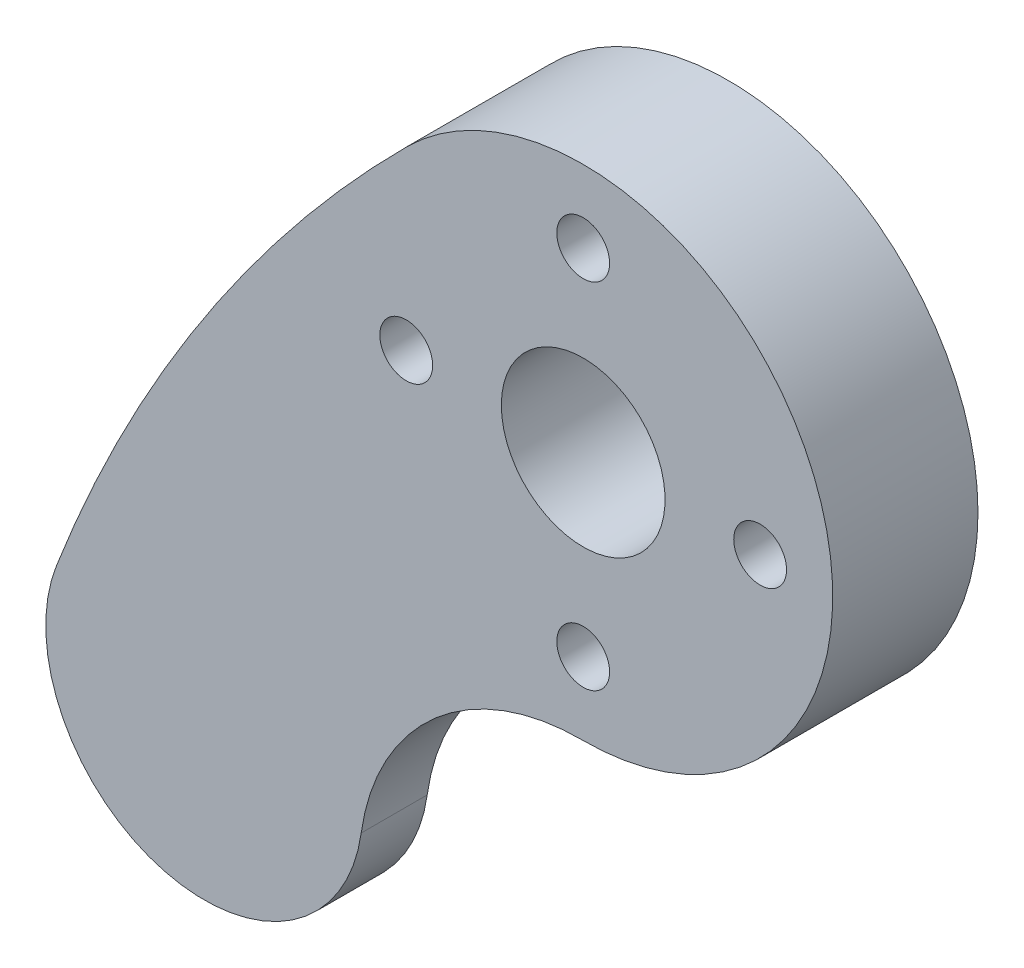
from build123d import *
from build123d.topology import SkipClean

# Parameters (mm, degrees)
BOSS_EXTRUDE1_DEPTH = 3.175
BOSS_EXTRUDE2_START = 3.81
SKETCH2_R           = 12
BOSS_EXTRUDE2_DEPTH = 3.81
SKETCH3_R           = 3.937
CUT_EXTRUDE1_DEPTH  = 134.099089527
SKETCH4_R           = 1.27
CUT_EXTRUDE2_DEPTH  = 134.099089527
CUT_EXTRUDE3_DEPTH  = 133.970273023


with BuildPart() as part:
    # Sketch1 → Boss-Extrude1 (new body)
    with BuildSketch(Plane.XY):
        with BuildLine():
            ThreePointArc((113.784062988, 44.416608597), (112.542436022, 60.902914722), (96.014300162, 60.502100346))
            ThreePointArc((96.014300162, 60.502100346), (86.225733854, 48.445051897), (79.156979953, 34.616777747))
            ThreePointArc((79.156979953, 34.616777747), (81.153408489, 26.227218543), (89.699693339, 25.073335615))
            ThreePointArc((89.699693339, 25.073335615), (102.758092485, 33.479680479), (113.784062988, 44.416608597))
        make_face()
    extrude(amount=BOSS_EXTRUDE1_DEPTH)

    # Sketch2 → Boss-Extrude2 (add)
    with SkipClean():  # the faces are left unmerged after this step: merging them gives an invalid solid
        with BuildSketch(Plane(origin=(0, 0, 0), x_dir=(-1, 0, 0), z_dir=(0, 0, -1)).offset(BOSS_EXTRUDE2_START)):
            with Locations((-104.48925, 52.0065)):
                Circle(SKETCH2_R)
        extrude(amount=-BOSS_EXTRUDE2_DEPTH)

    # Sketch3 → Cut-Extrude1 (cut, through all)
    with SkipClean():  # the faces are left unmerged after this step: merging them gives an invalid solid
        with BuildSketch(Plane(origin=(0, 0, -3.81), x_dir=(-1, 0, 0), z_dir=(0, 0, -1))):
            with Locations((-104.48925, 52.0065)):
                Circle(SKETCH3_R)
        extrude(amount=-CUT_EXTRUDE1_DEPTH, mode=Mode.SUBTRACT)

    # Sketch4 → Cut-Extrude2 (cut, through all)
    with SkipClean():  # the faces are left unmerged after this step: merging them gives an invalid solid
        with BuildSketch(Plane(origin=(0, 0, -3.81), x_dir=(-1, 0, 0), z_dir=(0, 0, -1))):
            with Locations((-95.98025, 52.0065)):
                Circle(SKETCH4_R)
            with Locations((-112.99825, 52.0065)):
                Circle(SKETCH4_R)
            with Locations((-104.48925, 43.4975)):
                Circle(SKETCH4_R)
            with Locations((-104.48925, 60.5155)):
                Circle(SKETCH4_R)
        extrude(amount=-CUT_EXTRUDE2_DEPTH, mode=Mode.SUBTRACT)

    # Sketch5 → Cut-Extrude3 (cut, through all)
    with SkipClean():  # the faces are left unmerged after this step: merging them gives an invalid solid
        with BuildSketch(Plane(origin=(0, 0, 0), x_dir=(-1, 0, 0), z_dir=(0, 0, -1))):
            with BuildLine():
                ThreePointArc((-104.430493989, 40.006643845), (-109.606684651, 41.15238269), (-113.7840634, 44.4166091))
                ThreePointArc((-113.7840634, 44.4166091), (-102.758092767, 33.479680706), (-89.699693406, 25.073335649))
                ThreePointArc((-89.699693406, 25.073335649), (-92.462895691, 27.440507008), (-93.81346398, 30.819079549))
                ThreePointArc((-93.81346398, 30.819079549), (-97.397477458, 37.40567327), (-104.430493989, 40.006643845))
            make_face()
        extrude(amount=-CUT_EXTRUDE3_DEPTH, mode=Mode.SUBTRACT)


solid = part.part
